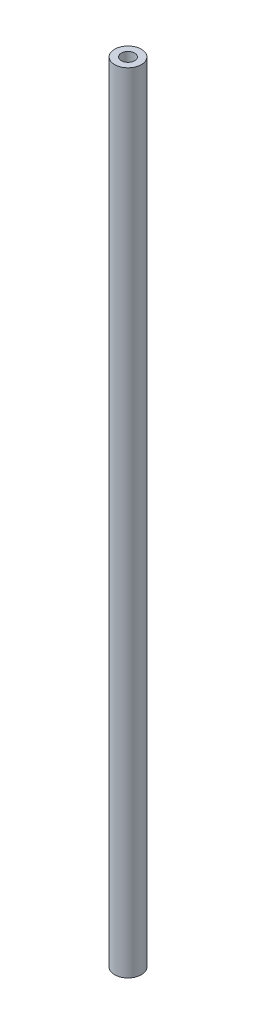
from build123d import *

# Parameters (mm, degrees)
SKETCH1_R           = 6.35
SKETCH1_R_2         = 3.175
BOSS_EXTRUDE1_DEPTH = 374.65


with BuildPart() as part:
    # Sketch1 → Boss-Extrude1 (new body)
    with BuildSketch(Plane(origin=(0, 0, 0), x_dir=(1, 0, 0), z_dir=(0, 1, 0))):
        Circle(SKETCH1_R)
        Circle(SKETCH1_R_2, mode=Mode.SUBTRACT)
    extrude(amount=BOSS_EXTRUDE1_DEPTH)


solid = part.part
